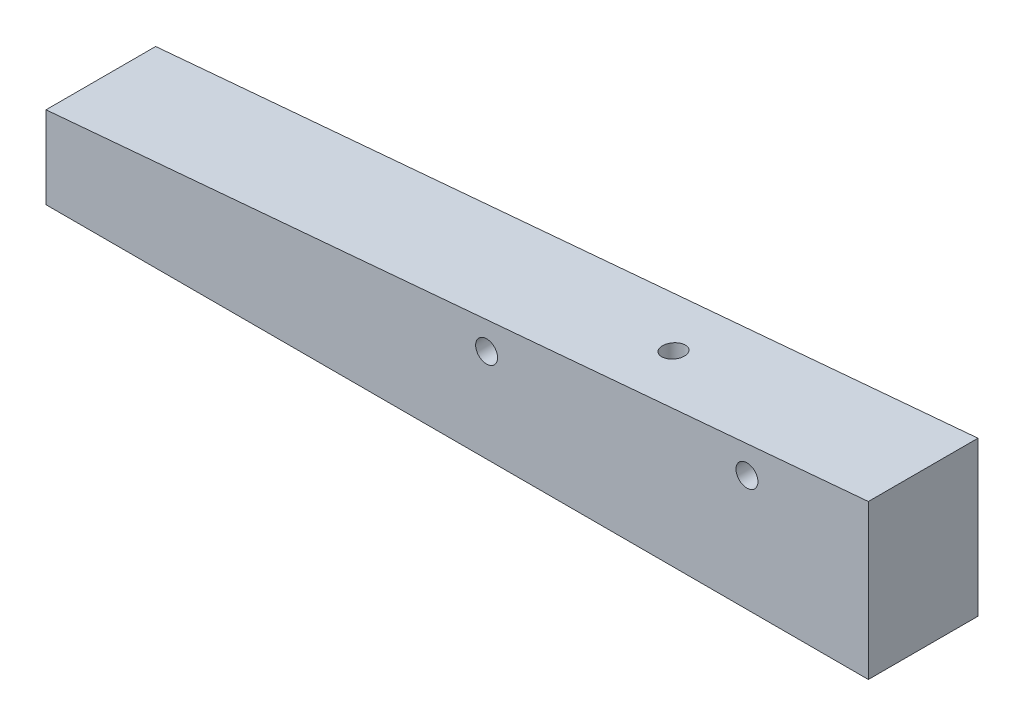
from build123d import *

# Parameters (mm, degrees)
BOSS_EXTRUDE1_DEPTH     = 10
CUT_EXTRUDE1_DEPTH      = 109.637330807
CUT_EXTRUDE1_DEPTH_BACK = 109.637330807
SKETCH2_R               = 2
CUT_EXTRUDE2_DEPTH      = 111.009407075
CUT_EXTRUDE2_DEPTH_BACK = 111.009407075
SKETCH3_R               = 2


with BuildPart() as part:
    # Sketch1 → Boss-Extrude1 (new, symmetric)
    with BuildSketch(Plane.XY):
        Polygon((45.543551331, 28.123299529), (-104.456448669, 15), (-104.456448669, 0), (45.543551331, 0), align=None)
    extrude(amount=BOSS_EXTRUDE1_DEPTH, both=True)

    # Sketch2 → Cut-Extrude1 (cut, two sides: drawn at the far end of the back side and taken through both)
    with BuildSketch(Plane.XZ.offset(-CUT_EXTRUDE1_DEPTH_BACK)):
        Circle(SKETCH2_R)
    extrude(amount=CUT_EXTRUDE1_DEPTH + CUT_EXTRUDE1_DEPTH_BACK, mode=Mode.SUBTRACT)

    # Sketch3 → Cut-Extrude2 (cut, two sides: drawn at the far end of the back side and taken through both)
    with BuildSketch(Plane(origin=(0, 0, -10), x_dir=(-1, 0, 0), z_dir=(0, 0, -1)).offset(-CUT_EXTRUDE2_DEPTH_BACK)):
        with Locations((-23.400226215, 21.166910421)):
            Circle(SKETCH3_R)
        with Locations((24.089449697, 17.012102144)):
            Circle(SKETCH3_R)
    extrude(amount=CUT_EXTRUDE2_DEPTH + CUT_EXTRUDE2_DEPTH_BACK, mode=Mode.SUBTRACT)


solid = part.part
